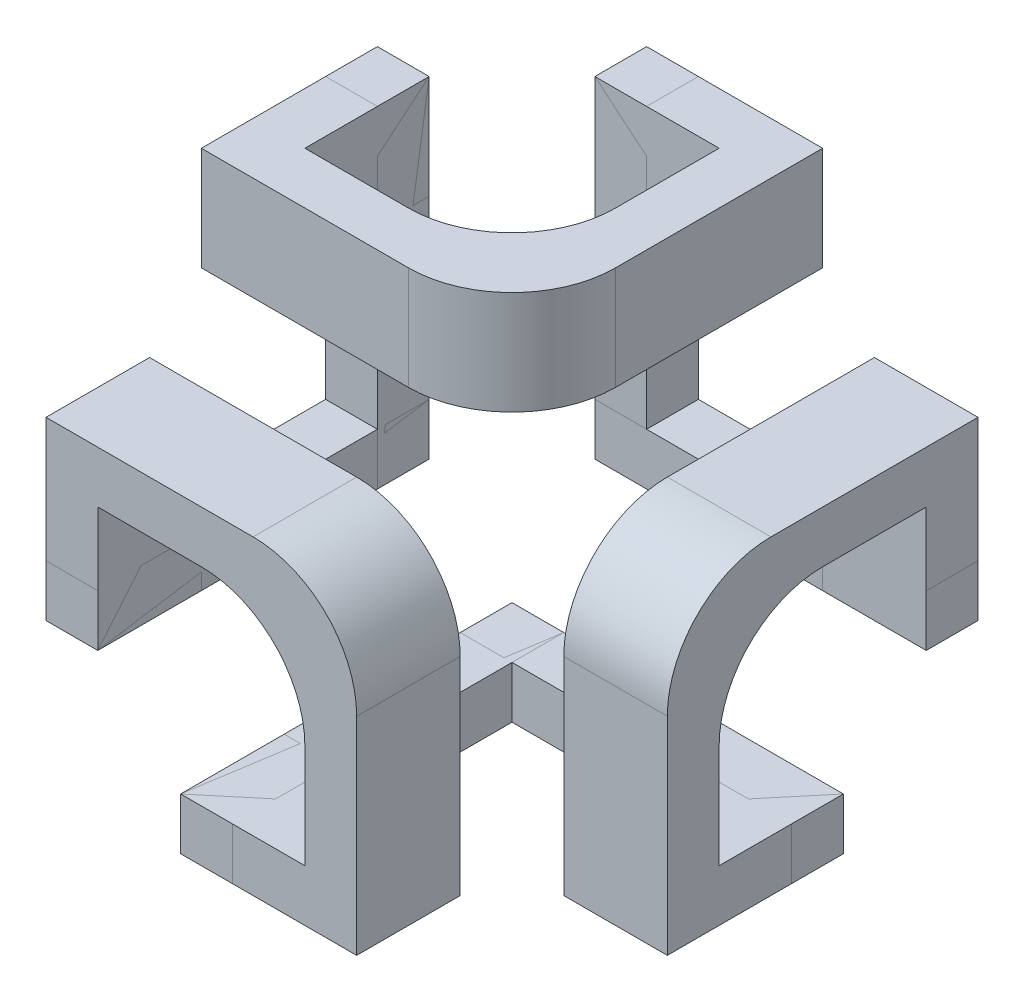
from build123d import *

# Parameters (mm, degrees)
BOSS_EXTRUDE1_DEPTH         = 10
BOSS_EXTRUDE2_START         = -32
SKETCH4_W                   = 5
SKETCH4_H                   = 5
BOSS_EXTRUDE2_DEPTH         = 32.000012
BOSS_EXTRUDE2_2_DEPTH       = 32.000012
BODY_MOVE_COPY2_START       = -7
BODY_MOVE_COPY2_OUTLINE_W   = 5
BODY_MOVE_COPY2_OUTLINE_H   = 32.000012
BODY_MOVE_COPY2_DEPTH       = 5
BODY_MOVE_COPY2_2_OUTLINE_W = 32.000012
BODY_MOVE_COPY2_2_OUTLINE_H = 5
BODY_MOVE_COPY2_2_DEPTH     = 5
BODY_MOVE_COPY2_START_2     = -20
BODY_MOVE_COPY2_3_OUTLINE_W = 5
BODY_MOVE_COPY2_3_OUTLINE_H = 32.000012
BODY_MOVE_COPY2_3_DEPTH     = 5
BODY_MOVE_COPY2_4_OUTLINE_W = 32.000012
BODY_MOVE_COPY2_4_OUTLINE_H = 5
BODY_MOVE_COPY2_4_DEPTH     = 5
BODY_MOVE_COPY2_START_3     = 15
BODY_MOVE_COPY2_5_DEPTH     = 10
BODY_MOVE_COPY2_6_DEPTH     = 10


# Read off the part's stored shape, not the designer's step: Body-Move/Copy2
with BuildPart() as part:
    # Sketch2 → Boss-Extrude1 (new body)
    with BuildSketch(Plane.XY.offset(15)):
        with BuildLine():
            ThreePointArc((0, 10), (7.071067812, 7.071067812), (10, 0))
            Line((10, 0), (10, -20))
            Line((10, -20), (-7, -20))
            Line((-7, -20), (-7, -15))
            Line((-7, -15), (5, -15))
            Line((5, -15), (5, -5))
            ThreePointArc((5, -5), (2.071067812, 2.071067812), (-5, 5))
            Line((-5, 5), (-15, 5))
            Line((-15, 5), (-15, -7))
            Line((-15, -7), (-20, -7))
            Line((-20, -7), (-20, 10))
            Line((-20, 10), (0, 10))
        make_face()
    extrude(amount=BOSS_EXTRUDE1_DEPTH)


with BuildPart() as body_2:
    # Sketch4 → Boss-Extrude2 (new body)
    with BuildSketch(Plane.XY.offset(25).offset(BOSS_EXTRUDE2_START)):
        with Locations((-17.5, -4.5)):
            Rectangle(SKETCH4_W, SKETCH4_H)
    extrude(amount=BOSS_EXTRUDE2_DEPTH)


with BuildPart() as body_3:
    # Sketch4 → Boss-Extrude2 2 (new body)
    with BuildSketch(Plane.XY.offset(25).offset(BOSS_EXTRUDE2_START)):
        with Locations((-4.5, -17.5)):
            Rectangle(SKETCH4_W, SKETCH4_H)
    extrude(amount=BOSS_EXTRUDE2_2_DEPTH)


with BuildPart() as body_4:
    # Body-Move/Copy2 outline → Body-Move/Copy2 (new body)
    with BuildSketch(Plane.XY.offset(BODY_MOVE_COPY2_START)):
        with Locations((-17.5, 9.000006)):
            Rectangle(BODY_MOVE_COPY2_OUTLINE_W, BODY_MOVE_COPY2_OUTLINE_H)
    extrude(amount=BODY_MOVE_COPY2_DEPTH)


with BuildPart() as body_5:
    # Body-Move_Copy2 2 outline → Body-Move_Copy2 2 (new body)
    with BuildSketch(Plane(origin=(0, 0, 0), x_dir=(1, 0, 0), z_dir=(0, 1, 0)).offset(BODY_MOVE_COPY2_START)):
        with Locations((9.000006, 17.5)):
            Rectangle(BODY_MOVE_COPY2_2_OUTLINE_W, BODY_MOVE_COPY2_2_OUTLINE_H)
    extrude(amount=BODY_MOVE_COPY2_2_DEPTH)


with BuildPart() as body_6:
    # Body-Move_Copy2 3 outline → Body-Move_Copy2 3 (new body)
    with BuildSketch(Plane.XY.offset(BODY_MOVE_COPY2_START_2)):
        with Locations((-4.5, 9.000006)):
            Rectangle(BODY_MOVE_COPY2_3_OUTLINE_W, BODY_MOVE_COPY2_3_OUTLINE_H)
    extrude(amount=BODY_MOVE_COPY2_3_DEPTH)


with BuildPart() as body_7:
    # Body-Move_Copy2 4 outline → Body-Move_Copy2 4 (new body)
    with BuildSketch(Plane(origin=(0, 0, 0), x_dir=(1, 0, 0), z_dir=(0, 1, 0)).offset(BODY_MOVE_COPY2_START_2)):
        with Locations((9.000006, 4.5)):
            Rectangle(BODY_MOVE_COPY2_4_OUTLINE_W, BODY_MOVE_COPY2_4_OUTLINE_H)
    extrude(amount=BODY_MOVE_COPY2_4_DEPTH)


with BuildPart() as body_8:
    # Body-Move_Copy2 5 outline → Body-Move_Copy2 5 (new body)
    with BuildSketch(Plane(origin=(0, 0, 0), x_dir=(1, 0, 0), z_dir=(0, 1, 0)).offset(BODY_MOVE_COPY2_START_3)):
        with BuildLine():
            ThreePointArc((0, -10), (7.071067812, -7.071067812), (10, 0))
            Line((10, 0), (10, 20))
            Line((10, 20), (-7, 20))
            Line((-7, 20), (-7, 15))
            Line((-7, 15), (5, 15))
            Line((5, 15), (5, 5))
            ThreePointArc((5, 5), (2.071067812, -2.071067812), (-5, -5))
            Line((-5, -5), (-15, -5))
            Line((-15, -5), (-15, 7))
            Line((-15, 7), (-20, 7))
            Line((-20, 7), (-20, -10))
            Line((-20, -10), (0, -10))
        make_face()
    extrude(amount=BODY_MOVE_COPY2_5_DEPTH)


with BuildPart() as body_9:
    # Body-Move_Copy2 6 outline → Body-Move_Copy2 6 (new body)
    with BuildSketch(Plane.YZ.offset(BODY_MOVE_COPY2_START_3)):
        with BuildLine():
            ThreePointArc((10, 0), (7.071067812, 7.071067812), (0, 10))
            Line((0, 10), (-20, 10))
            Line((-20, 10), (-20, -7))
            Line((-20, -7), (-15, -7))
            Line((-15, -7), (-15, 5))
            Line((-15, 5), (-5, 5))
            ThreePointArc((-5, 5), (2.071067812, 2.071067812), (5, -5))
            Line((5, -5), (5, -15))
            Line((5, -15), (-7, -15))
            Line((-7, -15), (-7, -20))
            Line((-7, -20), (10, -20))
            Line((10, -20), (10, 0))
        make_face()
    extrude(amount=BODY_MOVE_COPY2_6_DEPTH)


solid = Compound([part.part, body_2.part, body_3.part, body_4.part, body_5.part, body_6.part, body_7.part, body_8.part, body_9.part])
